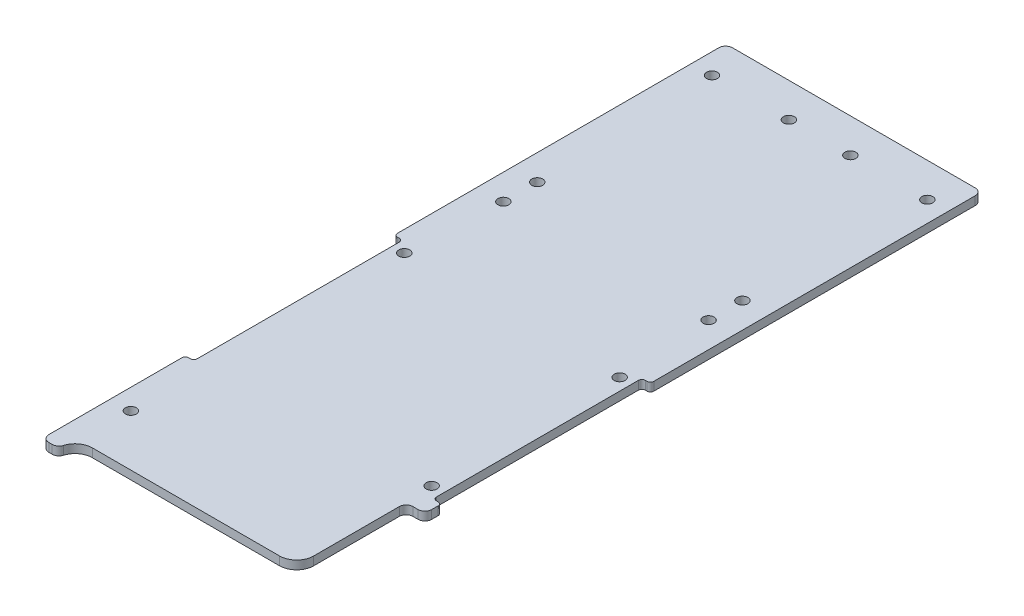
from build123d import *

# Parameters (mm, degrees)
SKETCH1_R               = 2.032
BOSS_EXTRUDE1_DEPTH     = 3.175
FILLET1_R               = 2.54
FILLET2_R               = 2.54
FILLET3_R               = 6.35
CUT_EXTRUDE1_DEPTH      = 136.673215063
FILLET4_R               = 6.35
FILLET5_R               = 2.54
SKETCH3_R               = 2.032
CUT_EXTRUDE2_DEPTH      = 136.673215063
CUT_EXTRUDE3_DEPTH      = 136.673215063
CUT_EXTRUDE3_DEPTH_BACK = 136.673215063
SKETCH4_W               = 3.174996482
SKETCH4_H               = 77.591915863
SKETCH4_W_2             = 3.175003518
FILLET6_R               = 1.27


with BuildPart() as part:
    # Sketch1 → Boss-Extrude1 (new body)
    with BuildSketch(Plane(origin=(0, 0, 0), x_dir=(1, 0, 0), z_dir=(0, 1, 0))):
        Polygon((47.625, 127), (-47.625, 127), (-47.625, -127), (-41.275, -127), (-41.275, -120.65), (41.275, -120.65), (41.275, -127), (47.625, -127), align=None)
        with Locations((-39.999684148, -101.6)):
            Circle(SKETCH1_R, mode=Mode.SUBTRACT)
        with Locations((39.999684148, -69.85)):
            Circle(SKETCH1_R, mode=Mode.SUBTRACT)
        with Locations((-39.999684148, 0)):
            Circle(SKETCH1_R, mode=Mode.SUBTRACT)
        with Locations((-39.999684148, 114.3)):
            Circle(SKETCH1_R, mode=Mode.SUBTRACT)
        with Locations((-11.424684148, 114.3)):
            Circle(SKETCH1_R, mode=Mode.SUBTRACT)
        with Locations((39.999684148, 0)):
            Circle(SKETCH1_R, mode=Mode.SUBTRACT)
        with Locations((11.424684148, 114.3)):
            Circle(SKETCH1_R, mode=Mode.SUBTRACT)
        with Locations((39.999684148, 114.3)):
            Circle(SKETCH1_R, mode=Mode.SUBTRACT)
    extrude(amount=BOSS_EXTRUDE1_DEPTH)

    # Fillet1
    fillet1_edges = [part.edges().sort_by_distance(p)[0] for p in [
        (-47.625, 1.5875, -127),
        (47.625, 1.5875, -127),
        (47.625, 1.5875, 127),
        (-47.625, 1.5875, 127),
    ]]
    fillet(fillet1_edges, radius=FILLET1_R)

    # Fillet2
    fillet2_edges = [part.edges().sort_by_distance(p)[0] for p in [
        (41.275, 1.5875, 127),
        (-41.275, 1.5875, 127),
    ]]
    fillet(fillet2_edges, radius=FILLET2_R)

    # Fillet3
    fillet3_edges = [part.edges().sort_by_distance(p)[0] for p in [
        (41.275, 1.5875, 120.65),
        (-41.275, 1.5875, 120.65),
    ]]
    fillet(fillet3_edges, radius=FILLET3_R)

    # Sketch2 → Cut-Extrude1 (cut, through all)
    with BuildSketch(Plane.XZ):
        with BuildLine():
            Line((47.625, 131.883089137), (41.912365611, 131.883089137))
            Line((41.912365611, 131.883089137), (41.912365611, 126.142730633))
            ThreePointArc((41.912365611, 126.142730633), (41.594452971, 125.6931954), (41.380880287, 125.185714286))
            ThreePointArc((41.380880287, 125.185714286), (41.068117609, 124.354187995), (40.642365611, 123.574449769))
            Line((40.642365611, 123.574449769), (40.642365611, 79.981419179))
            Line((40.642365611, 79.981419179), (47.625, 79.981419179))
            Line((47.625, 79.981419179), (47.625, 131.883089137))
        make_face()
    extrude(amount=-CUT_EXTRUDE1_DEPTH, mode=Mode.SUBTRACT)

    # Fillet4
    fillet4_edges = [part.edges().sort_by_distance(p)[0] for p in [
        (40.642365611, 1.5875, 123.574449769),
    ]]
    fillet(fillet4_edges, radius=FILLET4_R)

    # Fillet5
    fillet5_edges = [part.edges().sort_by_distance(p)[0] for p in [
        (47.625, 1.5875, 79.981419179),
        (40.642365611, 1.5875, 79.981419179),
    ]]
    fillet(fillet5_edges, radius=FILLET5_R)

    # Sketch3 → Cut-Extrude2 (cut, through all)
    with BuildSketch(Plane.XZ):
        with Locations((-38.111557814, -34.913768806)):
            Circle(SKETCH3_R)
        with Locations((-38.111557814, -47.490173279)):
            Circle(SKETCH3_R)
        with Locations((38.111557814, -47.490173279)):
            Circle(SKETCH3_R)
        with Locations((38.111557814, -34.913768806)):
            Circle(SKETCH3_R)
    extrude(amount=-CUT_EXTRUDE2_DEPTH, mode=Mode.SUBTRACT)

    # Sketch4 → Cut-Extrude3 (cut, two sides: drawn at the far end of the back side and taken through both)
    with BuildSketch(Plane(origin=(0, 3.175, 0), x_dir=(1, 0, 0), z_dir=(0, 1, 0)).offset(-CUT_EXTRUDE3_DEPTH_BACK)):
        with Locations((-46.037501759, -34.985947274)):
            Rectangle(SKETCH4_W, SKETCH4_H)
        with Locations((46.037498241, -34.985947274)):
            Rectangle(SKETCH4_W_2, SKETCH4_H)
    extrude(amount=CUT_EXTRUDE3_DEPTH + CUT_EXTRUDE3_DEPTH_BACK, mode=Mode.SUBTRACT)

    # Fillet6
    fillet6_edges = [part.edges().sort_by_distance(p)[0] for p in [
        (-44.450003518, 1.5875, -3.810010658),
        (-44.450003518, 1.5875, 73.781905205),
        (44.449996482, 1.5875, -3.810010658),
        (44.449996482, 1.5875, 73.781905205),
        (47.625, 1.5875, 73.781905205),
        (47.625, 1.5875, -3.810010658),
        (-47.625, 1.5875, 73.781905205),
        (-47.625, 1.5875, -3.810010658),
    ]]
    fillet(fillet6_edges, radius=FILLET6_R)


solid = part.part
